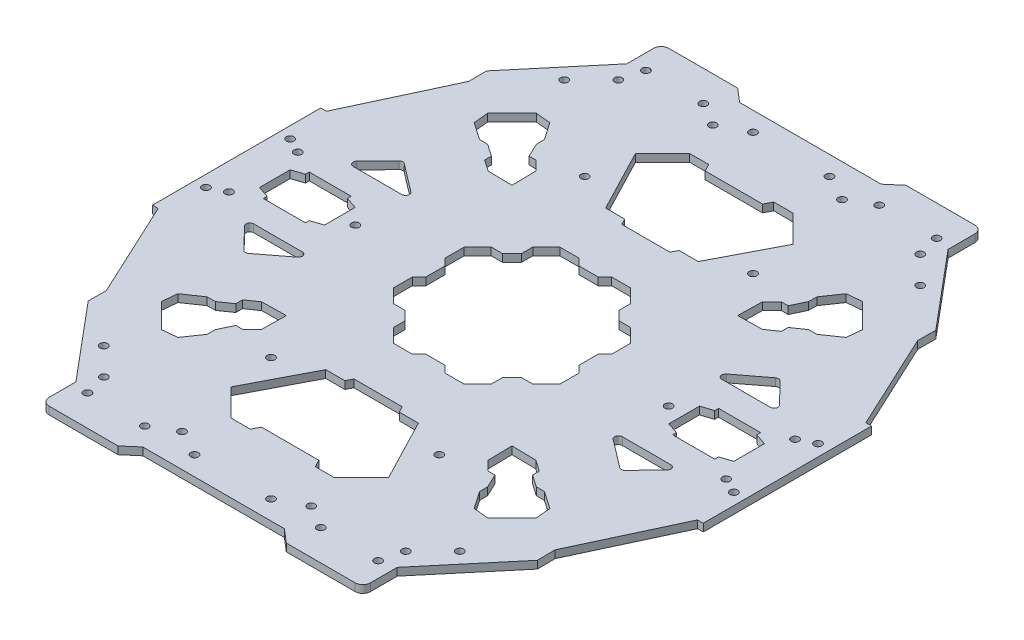
from build123d import *
from build123d.topology import SkipClean

# Parameters (mm, degrees)
SKETCH2_R                                  = 1
BOSS_EXTRUDE1_DEPTH                        = 2
MIRROR2_AT_THE_SECOND_PLANE_COPY_1_SKETC_R = 1
MIRROR2_AT_THE_SECOND_PLANE_COPY_1_DEPTH   = 2


with BuildPart() as part:
    # Sketch2 → Boss-Extrude1 (new body)
    with BuildSketch(Plane(origin=(0, 0, 0), x_dir=(1, 0, 0), z_dir=(0, 1, 0))):
        with BuildLine():
            Line((0, 58), (0, 78))
            Line((0, 78), (-18.5, 78))
            Line((-18.5, 78), (-22, 81))
            Line((-22, 81), (-40, 81))
            ThreePointArc((-40, 81), (-41.414213562, 80.414213562), (-42, 79))
            Line((-42, 79), (-42, 72))
            Line((-42, 72), (-58.712477852, 52.082844479))
            Line((-58.712477852, 52.082844479), (-58.668059631, 47.390805138))
            Line((-58.668059631, 47.390805138), (-70.501370959, 22.014187101))
            Line((-70.501370959, 22.014187101), (-72, 22))
            Line((-72, 22), (-72, 0))
            Line((-72, 0), (-62, 0))
            Line((-62, 0), (-62, 4))
            Line((-62, 4), (-59, 5))
            Line((-59, 5), (-59, 6))
            Line((-59, 6), (-48, 6))
            Line((-48, 6), (-48, 5))
            Line((-48, 5), (-45, 4))
            Line((-45, 4), (-45, 0))
            Line((-45, 0), (-41.957469428, 0))
            ThreePointArc((-41.957469428, 0), (-40.957469428, 1), (-39.957469428, 0))
            Line((-39.957469428, 0), (-20, 0))
            Line((-20, 0), (-20, 2.5))
            Line((-20, 2.5), (-21.767766953, 4.267766953))
            Line((-21.767766953, 4.267766953), (-21.767766953, 9.267766953))
            Line((-21.767766953, 9.267766953), (-18.232233047, 12.803300859))
            Line((-18.232233047, 12.803300859), (-15.232233047, 12.803300859))
            Line((-15.232233047, 12.803300859), (-12.803300859, 15.232233047))
            Line((-12.803300859, 15.232233047), (-12.803300859, 18.232233047))
            Line((-12.803300859, 18.232233047), (-9.267766953, 21.767766953))
            Line((-9.267766953, 21.767766953), (-4.267766953, 21.767766953))
            Line((-4.267766953, 21.767766953), (-2.5, 20))
            Line((-2.5, 20), (0, 20))
            Line((0, 20), (0, 35))
            Line((0, 35), (-6.286398777, 35))
            Line((-6.286398777, 35), (-7.109651615, 36.582868135))
            Line((-7.109651615, 36.582868135), (-12.109651615, 36.582868135))
            Line((-12.109651615, 36.582868135), (-20.571067812, 52.851632072))
            Line((-20.571067812, 52.851632072), (-13.5, 59.922699883))
            Line((-13.5, 59.922699883), (-8.5, 59.922699883))
            Line((-8.5, 59.922699883), (-7.5, 58))
            Line((-7.5, 58), (0, 58))
        make_face()
        with Locations((-65, 9)):
            Circle(SKETCH2_R, mode=Mode.SUBTRACT)
        with Locations((-69, 11)):
            Circle(SKETCH2_R, mode=Mode.SUBTRACT)
        with BuildLine():
            Line((-41.839840722, 13), (-54.515368917, 13))
            ThreePointArc((-54.515368917, 13), (-55.43650129, 13.610750528), (-55.232469497, 14.696969697))
            Line((-55.232469497, 14.696969697), (-49.833633414, 20.251742741))
            ThreePointArc((-49.833633414, 20.251742741), (-49.190282447, 20.552049833), (-48.50975542, 20.349644839))
            Line((-48.50975542, 20.349644839), (-41.233063308, 14.794871795))
            ThreePointArc((-41.233063308, 14.794871795), (-40.892509789, 13.679743692), (-41.839840722, 13))
        make_face(mode=Mode.SUBTRACT)
        Polygon((-48.630106489, 38.730611552), (-49.00437522, 42.64041419), (-42.64041419, 49.00437522), (-38.730611552, 48.630106489), (-35.620672262, 44.105953636), (-35.581831384, 41.945792414), (-33.875458568, 38.327994412), (-32.107711092, 38.327994412), (-29.61074684, 35.83103016), (-29.496854911, 29.496854911), (-35.83103016, 29.61074684), (-38.790556383, 31.645149121), (-38.790556383, 33.412896597), (-41.945792414, 35.581831384), (-44.105953636, 35.620672262), align=None, mode=Mode.SUBTRACT)
        with Locations((-46.526420816, 60.182905253)):
            Circle(SKETCH2_R, mode=Mode.SUBTRACT)
        with Locations((-39.455353004, 67.253973065)):
            Circle(SKETCH2_R, mode=Mode.SUBTRACT)
        with Locations((-38, 73)):
            Circle(SKETCH2_R, mode=Mode.SUBTRACT)
        with Locations((-22, 41)):
            Circle(SKETCH2_R, mode=Mode.SUBTRACT)
        with Locations((-23, 73)):
            Circle(SKETCH2_R, mode=Mode.SUBTRACT)
        with Locations((-16.882181673, 69.385939502)):
            Circle(SKETCH2_R, mode=Mode.SUBTRACT)
        with Locations((-10, 73)):
            Circle(SKETCH2_R, mode=Mode.SUBTRACT)
    boss_extrude1 = extrude(amount=BOSS_EXTRUDE1_DEPTH)

    # Mirror2: Boss-Extrude1 across plane
    add(boss_extrude1.mirror(Plane(origin=(0, 0, 0), x_dir=(0, 0, 1), z_dir=(1, 0, 0))))

    # Mirror2 at the second plane: Boss-Extrude1 across plane
    with SkipClean():  # the faces are left unmerged after this step: merging them gives an invalid solid
        add(boss_extrude1.mirror(Plane.XY))

    # Mirror2 at the second plane copy 1 sketc → Mirror2 at the second plane copy 1 (add)
    with SkipClean():  # the faces are left unmerged after this step: merging them gives an invalid solid
        with BuildSketch(Plane(origin=(0, 0, 0), x_dir=(-1, 0, 0), z_dir=(0, 1, 0))):
            with BuildLine():
                Line((0, 58), (0, 78))
                Line((0, 78), (-18.5, 78))
                Line((-18.5, 78), (-22, 81))
                Line((-22, 81), (-40, 81))
                ThreePointArc((-40, 81), (-41.414213562, 80.414213562), (-42, 79))
                Line((-42, 79), (-42, 72))
                Line((-42, 72), (-58.712477852, 52.082844479))
                Line((-58.712477852, 52.082844479), (-58.668059631, 47.390805138))
                Line((-58.668059631, 47.390805138), (-70.501370959, 22.014187101))
                Line((-70.501370959, 22.014187101), (-72, 22))
                Line((-72, 22), (-72, 0))
                Line((-72, 0), (-62, 0))
                Line((-62, 0), (-62, 4))
                Line((-62, 4), (-59, 5))
                Line((-59, 5), (-59, 6))
                Line((-59, 6), (-48, 6))
                Line((-48, 6), (-48, 5))
                Line((-48, 5), (-45, 4))
                Line((-45, 4), (-45, 0))
                Line((-45, 0), (-41.957469428, 0))
                ThreePointArc((-41.957469428, 0), (-40.957469428, 1), (-39.957469428, 0))
                Line((-39.957469428, 0), (-20, 0))
                Line((-20, 0), (-20, 2.5))
                Line((-20, 2.5), (-21.767766953, 4.267766953))
                Line((-21.767766953, 4.267766953), (-21.767766953, 9.267766953))
                Line((-21.767766953, 9.267766953), (-18.232233047, 12.803300859))
                Line((-18.232233047, 12.803300859), (-15.232233047, 12.803300859))
                Line((-15.232233047, 12.803300859), (-12.803300859, 15.232233047))
                Line((-12.803300859, 15.232233047), (-12.803300859, 18.232233047))
                Line((-12.803300859, 18.232233047), (-9.267766953, 21.767766953))
                Line((-9.267766953, 21.767766953), (-4.267766953, 21.767766953))
                Line((-4.267766953, 21.767766953), (-2.5, 20))
                Line((-2.5, 20), (0, 20))
                Line((0, 20), (0, 35))
                Line((0, 35), (-6.286398777, 35))
                Line((-6.286398777, 35), (-7.109651615, 36.582868135))
                Line((-7.109651615, 36.582868135), (-12.109651615, 36.582868135))
                Line((-12.109651615, 36.582868135), (-20.571067812, 52.851632072))
                Line((-20.571067812, 52.851632072), (-13.5, 59.922699883))
                Line((-13.5, 59.922699883), (-8.5, 59.922699883))
                Line((-8.5, 59.922699883), (-7.5, 58))
                Line((-7.5, 58), (0, 58))
            make_face()
            with Locations((-65, 9)):
                Circle(MIRROR2_AT_THE_SECOND_PLANE_COPY_1_SKETC_R, mode=Mode.SUBTRACT)
            with Locations((-69, 11)):
                Circle(MIRROR2_AT_THE_SECOND_PLANE_COPY_1_SKETC_R, mode=Mode.SUBTRACT)
            with BuildLine():
                Line((-41.839840722, 13), (-54.515368917, 13))
                ThreePointArc((-54.515368917, 13), (-55.43650129, 13.610750528), (-55.232469497, 14.696969697))
                Line((-55.232469497, 14.696969697), (-49.833633414, 20.251742741))
                ThreePointArc((-49.833633414, 20.251742741), (-49.190282447, 20.552049833), (-48.50975542, 20.349644839))
                Line((-48.50975542, 20.349644839), (-41.233063308, 14.794871795))
                ThreePointArc((-41.233063308, 14.794871795), (-40.892509789, 13.679743692), (-41.839840722, 13))
            make_face(mode=Mode.SUBTRACT)
            Polygon((-48.630106489, 38.730611552), (-49.00437522, 42.64041419), (-42.64041419, 49.00437522), (-38.730611552, 48.630106489), (-35.620672262, 44.105953636), (-35.581831384, 41.945792414), (-33.875458568, 38.327994412), (-32.107711092, 38.327994412), (-29.61074684, 35.83103016), (-29.496854911, 29.496854911), (-35.83103016, 29.61074684), (-38.790556383, 31.645149121), (-38.790556383, 33.412896597), (-41.945792414, 35.581831384), (-44.105953636, 35.620672262), align=None, mode=Mode.SUBTRACT)
            with Locations((-46.526420816, 60.182905253)):
                Circle(MIRROR2_AT_THE_SECOND_PLANE_COPY_1_SKETC_R, mode=Mode.SUBTRACT)
            with Locations((-39.455353004, 67.253973065)):
                Circle(MIRROR2_AT_THE_SECOND_PLANE_COPY_1_SKETC_R, mode=Mode.SUBTRACT)
            with Locations((-38, 73)):
                Circle(MIRROR2_AT_THE_SECOND_PLANE_COPY_1_SKETC_R, mode=Mode.SUBTRACT)
            with Locations((-22, 41)):
                Circle(MIRROR2_AT_THE_SECOND_PLANE_COPY_1_SKETC_R, mode=Mode.SUBTRACT)
            with Locations((-23, 73)):
                Circle(MIRROR2_AT_THE_SECOND_PLANE_COPY_1_SKETC_R, mode=Mode.SUBTRACT)
            with Locations((-16.882181673, 69.385939502)):
                Circle(MIRROR2_AT_THE_SECOND_PLANE_COPY_1_SKETC_R, mode=Mode.SUBTRACT)
            with Locations((-10, 73)):
                Circle(MIRROR2_AT_THE_SECOND_PLANE_COPY_1_SKETC_R, mode=Mode.SUBTRACT)
        extrude(amount=MIRROR2_AT_THE_SECOND_PLANE_COPY_1_DEPTH)


solid = part.part
